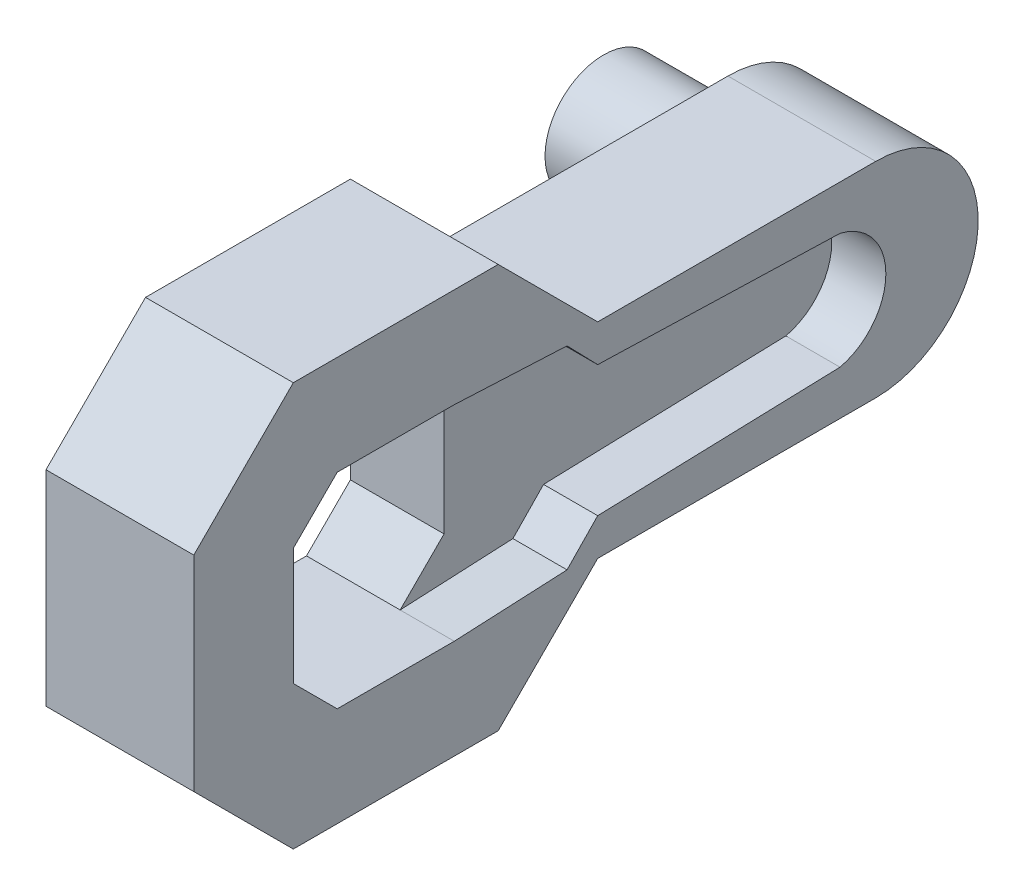
from build123d import *
from build123d.topology import SkipClean

# Parameters (mm, degrees)
SKETCH1_W           = 7
SKETCH1_H           = 7
BOSS_EXTRUDE1_DEPTH = 3.2
CHAMFER1_SIZE       = 1.5
FILLET1_R           = 3.5
CHAMFER2_SIZE       = 3.4
SKETCH3_R           = 2
BOSS_EXTRUDE2_DEPTH = 4.25
BOSS_EXTRUDE3_DEPTH = 1.85
BOSS_EXTRUDE4_DEPTH = 1.85


with BuildPart() as part:
    # Sketch1 → Boss-Extrude1 (new body)
    with BuildSketch(Plane(origin=(0, 0, 0), x_dir=(0, 0, -1), z_dir=(1, 0, 0))):
        Polygon((6.9, 3.5), (6.9, 6.9), (-6.9, 6.9), (-6.9, -6.9), (6.9, -6.9), (6.9, -3.5), (19.9, -3.5), (19.9, 3.5), align=None)
        Rectangle(SKETCH1_W, SKETCH1_H, mode=Mode.SUBTRACT)
    extrude(amount=BOSS_EXTRUDE1_DEPTH)

    # Chamfer1
    chamfer1_edges = [part.edges().sort_by_distance(p)[0] for p in [
        (1.6, -3.5, -3.5),
        (1.6, 3.5, -3.5),
        (1.6, 3.5, 3.5),
        (1.6, -3.5, 3.5),
    ]]
    chamfer(chamfer1_edges, length=CHAMFER1_SIZE)

    # Fillet1
    fillet1_edges = [part.edges().sort_by_distance(p)[0] for p in [
        (1.6, -3.5, -19.9),
        (1.6, 3.5, -19.9),
    ]]
    fillet(fillet1_edges, radius=FILLET1_R - 0.0001)  # a hair under: the kernel refuses the full size

    # Chamfer2
    chamfer2_edges = [part.edges().sort_by_distance(p)[0] for p in [
        (1.6, -6.9, -6.9),
        (1.6, -6.9, 6.9),
        (1.6, 6.9, 6.9),
        (1.6, 6.9, -6.9),
    ]]
    chamfer(chamfer2_edges, length=CHAMFER2_SIZE - 0.0001)  # a hair under: the kernel refuses the full size

    # Sketch3 → Boss-Extrude2 (add)
    with BuildSketch(Plane.ZY):
        with Locations(Location((-16.4, 0, 0), (0, 0, 180))):
            Circle(SKETCH3_R)
    extrude(amount=BOSS_EXTRUDE2_DEPTH)

    # Sketch4 → Boss-Extrude3 (add)
    with BuildSketch(Plane(origin=(3.2, 0, 0), x_dir=(0, 0, -1), z_dir=(1, 0, 0))):
        with BuildLine():
            Line((6.9, 2.234550653), (15.178957615, 1.979760355))
            ThreePointArc((15.178957615, 1.979760355), (16.745857217, 0), (15.178957615, -1.979760355))
            Line((15.178957615, -1.979760355), (6.9, -2.234550653))
            Line((6.9, -2.234550653), (5.852935753, -3.314334724))
            Line((5.852935753, -3.314334724), (15.305699084, -3.023419792))
            ThreePointArc((15.305699084, -3.023419792), (17.792921464, 0), (15.305699084, 3.023419792))
            Line((15.305699084, 3.023419792), (5.852935753, 3.314334724))
            Line((5.852935753, 3.314334724), (6.9, 2.234550653))
        make_face()
    extrude(amount=BOSS_EXTRUDE3_DEPTH)

    # Sketch5 → Boss-Extrude4 (add)
    with SkipClean():  # the faces are left unmerged after this step: merging them gives an invalid solid
        with BuildSketch(Plane(origin=(3.2, 0, 0), x_dir=(0, 0, -1), z_dir=(1, 0, 0))):
            with BuildLine():
                Line((-6.9, -3.5), (-3.5, -6.9))
                Line((-3.5, -6.9), (3.5, -6.9))
                Line((3.5, -6.9), (6.9, -3.5))
                Line((6.9, -3.5), (16.4, -3.5))
                ThreePointArc((16.4, -3.5), (18.874873734, -2.474873734), (19.9, 0))
                ThreePointArc((19.9, 0), (18.874873734, 2.474873734), (16.4, 3.5))
                Line((16.4, 3.5), (6.9, 3.5))
                Line((6.9, 3.5), (3.5, 6.9))
                Line((3.5, 6.9), (-3.5, 6.9))
                Line((-3.5, 6.9), (-6.9, 3.5))
                Line((-6.9, 3.5), (-6.9, -3.5))
            make_face()
            with BuildLine():
                Line((5.852935753, -3.314334724), (2, -3.5))
                Line((2, -3.5), (-2, -3.5))
                Line((-2, -3.5), (-3.5, -2))
                Line((-3.5, -2), (-3.5, 2))
                Line((-3.5, 2), (-2, 3.5))
                Line((-2, 3.5), (2, 3.5))
                Line((2, 3.5), (5.852935753, 3.314334724))
                Line((5.852935753, 3.314334724), (15.305699084, 3.023419792))
                ThreePointArc((15.305699084, 3.023419792), (17.792921464, 0), (15.305699084, -3.023419792))
                Line((15.305699084, -3.023419792), (5.852935753, -3.314334724))
            make_face(mode=Mode.SUBTRACT)
        extrude(amount=BOSS_EXTRUDE4_DEPTH)


solid = part.part
